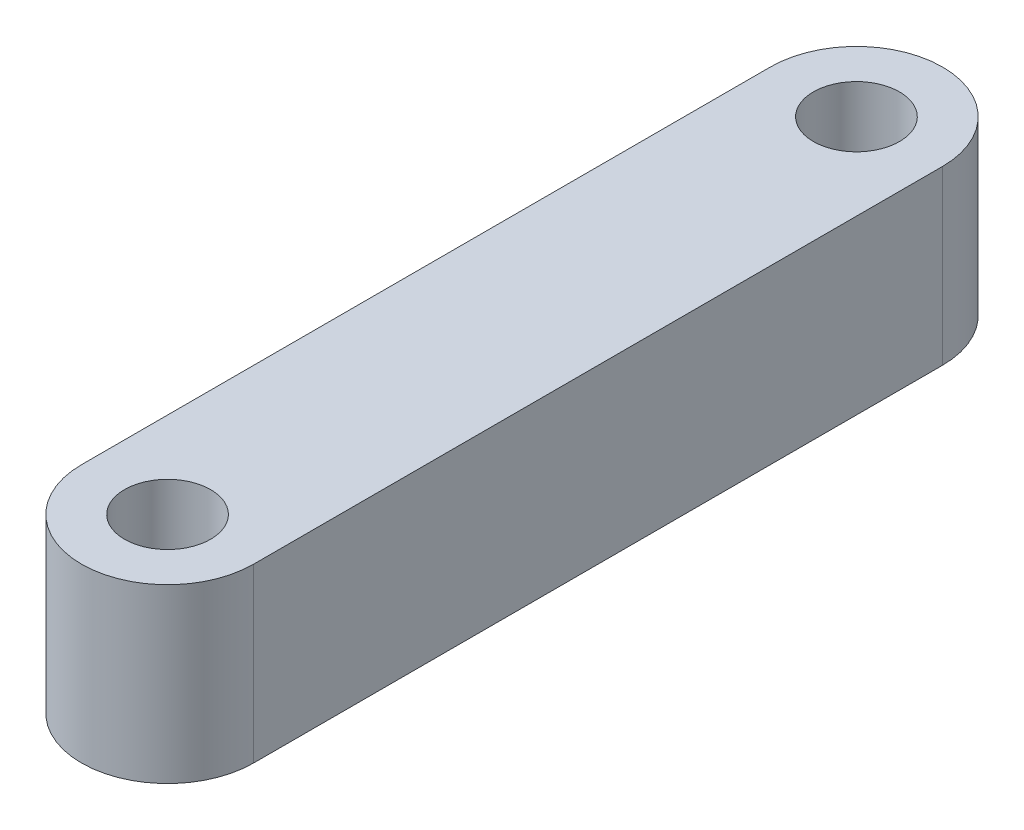
from build123d import *

# Parameters (mm, degrees)
SKETCH1_R           = 1.5875
BOSS_EXTRUDE1_DEPTH = 6.35


with BuildPart() as part:
    # Sketch1 → Boss-Extrude1 (new body)
    with BuildSketch(Plane(origin=(0, 0, 0), x_dir=(1, 0, 0), z_dir=(0, 1, 0))):
        with BuildLine():
            Line((-3.175, 25.399999799), (-3.175, 2.01e-07))
            ThreePointArc((-3.175, 2.01e-07), (0, -3.175), (3.175, 2.01e-07))
            Line((3.175, 2.01e-07), (3.175, 25.399999799))
            ThreePointArc((3.175, 25.399999799), (0, 28.575), (-3.175, 25.399999799))
        make_face()
        Circle(SKETCH1_R, mode=Mode.SUBTRACT)
        with Locations((0, 25.4)):
            Circle(SKETCH1_R, mode=Mode.SUBTRACT)
    extrude(amount=BOSS_EXTRUDE1_DEPTH)


solid = part.part
